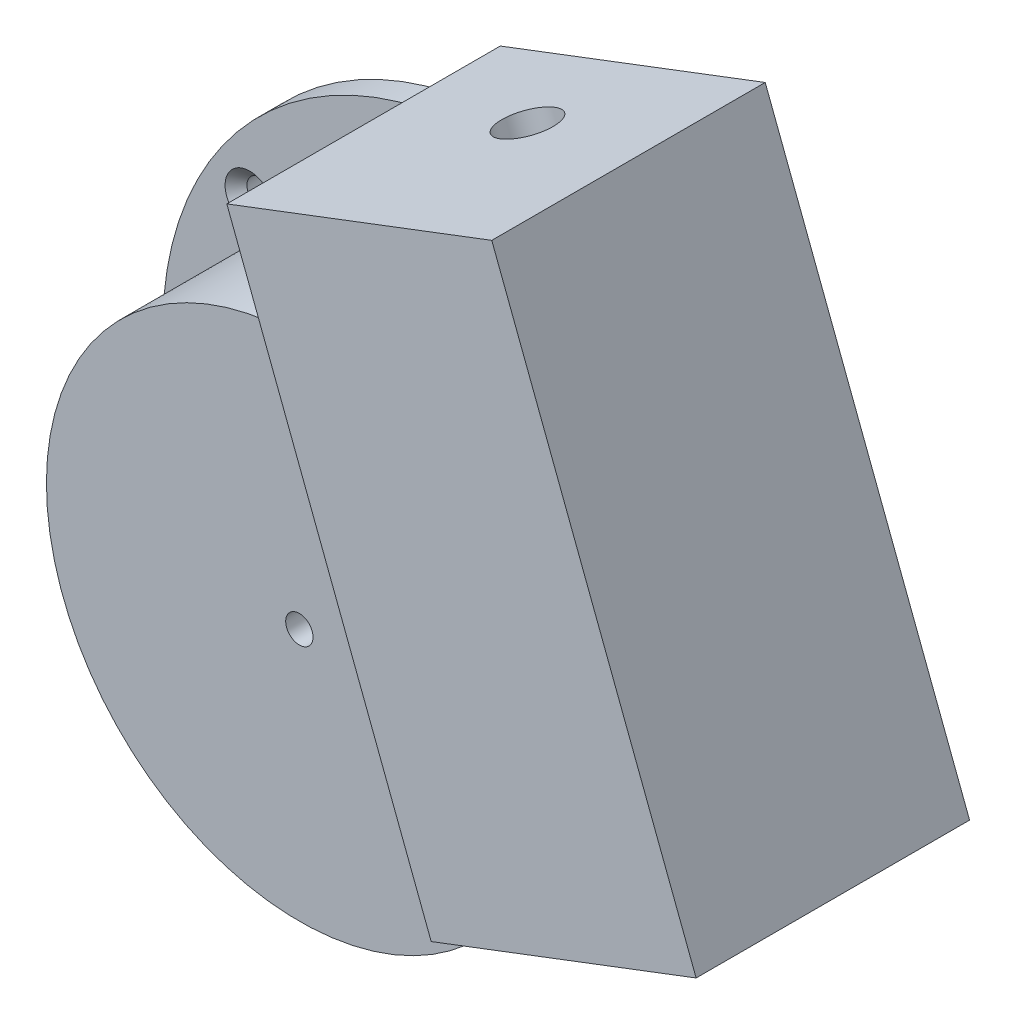
from build123d import *
from build123d.topology import SkipClean

# Parameters (mm, degrees)
ESTRUSIONE_ESTRUSIONE1_DEPTH             = 2
ESTRUSIONE_ESTRUSIONE3_DEPTH             = 12
ESTRUSIONE_ESTRUSIONE4_DEPTH             = 12
SCHIZZO7_R                               = 17.500000000000004
TAGLIO_ESTRUSIONE1_DEPTH                 = 12
ESTRUSIONE_ESTRUSIONE5_DEPTH             = 4
ESTRUSIONE_ESTRUSIONE6_DEPTH             = 2
SCHIZZO12_R                              = 18.5
ESTRUSIONE_ESTRUSIONE7_DEPTH             = 2
SCHIZZO13_R                              = 1
TAGLIO_ESTRUSIONE2_DEPTH                 = 2
SCHIZZO14_R                              = 2.000000000000003
TAGLIO_ESTRUSIONE3_DEPTH                 = 41
FORO_SVASATO_PER_VITE_M1_6_1_D           = 2
FORO_SVASATO_PER_VITE_M1_6_1_CSINK_D     = 3.6
FORO_SVASATO_PER_VITE_M1_6_1_CSINK_ANGLE = 90


with BuildPart() as part:
    # Schizzo1 → Estrusione-Estrusione1 (new body)
    with BuildSketch(Plane.XY):
        with BuildLine():
            Line((0.3284114046875099, 23.99775293541608), (-1.3053716119063685, 28.287904761479965))
            Line((-1.3053716119063685, 28.287904761479965), (18.07162291926499, 35.66708523367913))
            Line((18.07162291926499, 35.66708523367913), (33.01865815438378, -3.5823437644717075))
            Line((33.01865815438378, -3.5823437644717075), (22.80756216564372, -7.470950947523162))
            ThreePointArc((22.80756216564372, -7.470950947523162), (-19.529161509900902, -13.950335147235894), (0.3284114046875099, 23.99775293541608))
        make_face()
        with BuildLine():
            Line((2.8947011274367265, 17.25893117730112), (13.641663623212434, -10.961524236670856))
            ThreePointArc((13.641663623212434, -10.961524236670856), (-16.35424610719256, -6.228052204772934), (2.8947011274367265, 17.25893117730112))
        make_face(mode=Mode.SUBTRACT)
    extrude(amount=ESTRUSIONE_ESTRUSIONE1_DEPTH)

    # Schizzo3 → Estrusione-Estrusione3 (add)
    with SkipClean():  # the faces are left unmerged after this step: merging them gives an invalid solid
        with BuildSketch(Plane.XY.offset(2)):
            with BuildLine():
                Line((13.641663623212441, -10.961524236670847), (15.363636214328258, -10.305759665050466))
                ThreePointArc((15.363636214328258, -10.305759665050466), (-16.872624878138904, -7.587129214769445), (2.4859730865201266, 18.332210390814783))
                Line((2.4859730865201266, 18.332210390814783), (2.8947011274367274, 17.258931177301115))
                ThreePointArc((2.8947011274367274, 17.258931177301115), (-16.354246107192555, -6.228052204772932), (13.641663623212441, -10.961524236670847))
            make_face()
        extrude(amount=ESTRUSIONE_ESTRUSIONE3_DEPTH)

    # Schizzo5 → Estrusione-Estrusione4 (add)
    with SkipClean():  # the faces are left unmerged after this step: merging them gives an invalid solid
        with BuildSketch(Plane.XY.offset(2)):
            Polygon((2.8947011274367265, 17.25893117730112), (8.683861818797205, 7.676905089777334), (1.2754624808896886, 27.130625458346284), (16.91434361613132, 33.086251140883064), (30.437824061587722, -2.4250644613380326), (12.929886228381244, -9.092467538705995), (13.641663623212434, -10.961524236670856), (33.01865815438378, -3.5823437644717075), (18.07162291926499, 35.66708523367913), (-1.3053716119063685, 28.287904761479965), align=None)
        extrude(amount=ESTRUSIONE_ESTRUSIONE4_DEPTH)

    # Schizzo7 → Taglio-Estrusione1 (cut, symmetric)
    with SkipClean():  # the faces are left unmerged after this step: merging them gives an invalid solid
        with BuildSketch(Plane.XY.offset(2)):
            Circle(SCHIZZO7_R)
        extrude(amount=TAGLIO_ESTRUSIONE1_DEPTH, both=True, mode=Mode.SUBTRACT)

    # Schizzo10 → Estrusione-Estrusione5 (add)
    with SkipClean():  # the faces are left unmerged after this step: merging them gives an invalid solid
        with BuildSketch(Plane.XY.offset(14)):
            Polygon((33.01865815438378, -3.5823437644717075), (13.641663623212425, -10.961524236670874), (-1.3053716119063685, 28.287904761479965), (18.07162291926499, 35.66708523367913), align=None)
            Polygon((30.437824061587722, -2.4250644613380326), (14.79894292634609, -8.380690143874821), (1.2754624808896886, 27.130625458346284), (16.91434361613132, 33.086251140883064), align=None, mode=Mode.SUBTRACT)
        extrude(amount=ESTRUSIONE_ESTRUSIONE5_DEPTH)

    # Schizzo11 → Estrusione-Estrusione6 (add)
    with SkipClean():  # the faces are left unmerged after this step: merging them gives an invalid solid
        with BuildSketch(Plane.XY.offset(18.000000000000004)):
            Polygon((33.01865815438378, -3.5823437644717075), (13.641663623212425, -10.961524236670872), (-1.3053716119063685, 28.287904761479965), (18.07162291926499, 35.66708523367913), align=None)
        extrude(amount=ESTRUSIONE_ESTRUSIONE6_DEPTH)

    # Schizzo12 → Estrusione-Estrusione7 (add)
    with SkipClean():  # the faces are left unmerged after this step: merging them gives an invalid solid
        with BuildSketch(Plane.XY.offset(14)):
            Circle(SCHIZZO12_R)
        extrude(amount=ESTRUSIONE_ESTRUSIONE7_DEPTH)

    # Schizzo13 → Taglio-Estrusione2 (cut)
    with SkipClean():  # the faces are left unmerged after this step: merging them gives an invalid solid
        with BuildSketch(Plane.XY.offset(16)):
            Circle(SCHIZZO13_R)
        extrude(amount=-TAGLIO_ESTRUSIONE2_DEPTH, mode=Mode.SUBTRACT)

    # Schizzo14 → Taglio-Estrusione3 (cut)
    with SkipClean():  # the faces are left unmerged after this step: merging them gives an invalid solid
        with BuildSketch(Plane(origin=(-9.573553987230946, 25.13920129116486, 0), x_dir=(0.9345283489824324, 0.35588869741559553, 0), z_dir=(-0.35588869741559553, 0.9345283489824324, 0))):
            with Locations((19.001956434598885, -7.5)):
                Circle(SCHIZZO14_R)
        extrude(amount=-TAGLIO_ESTRUSIONE3_DEPTH, mode=Mode.SUBTRACT)

    # Foro svasato per Vite M1.6-1 (through all)
    with Locations(Plane(origin=(-0.772807947, 20.98577537, 2), x_dir=(1, 0, 0), z_dir=(0, 0, 1))):
        with Locations((0, 0), (-16.860997277, -9.581876329), (-10.631091094, -38.619580594), (18.406613171, -32.389674411)):
            CounterSinkHole(FORO_SVASATO_PER_VITE_M1_6_1_D / 2, FORO_SVASATO_PER_VITE_M1_6_1_CSINK_D / 2, counter_sink_angle=FORO_SVASATO_PER_VITE_M1_6_1_CSINK_ANGLE)


solid = part.part
